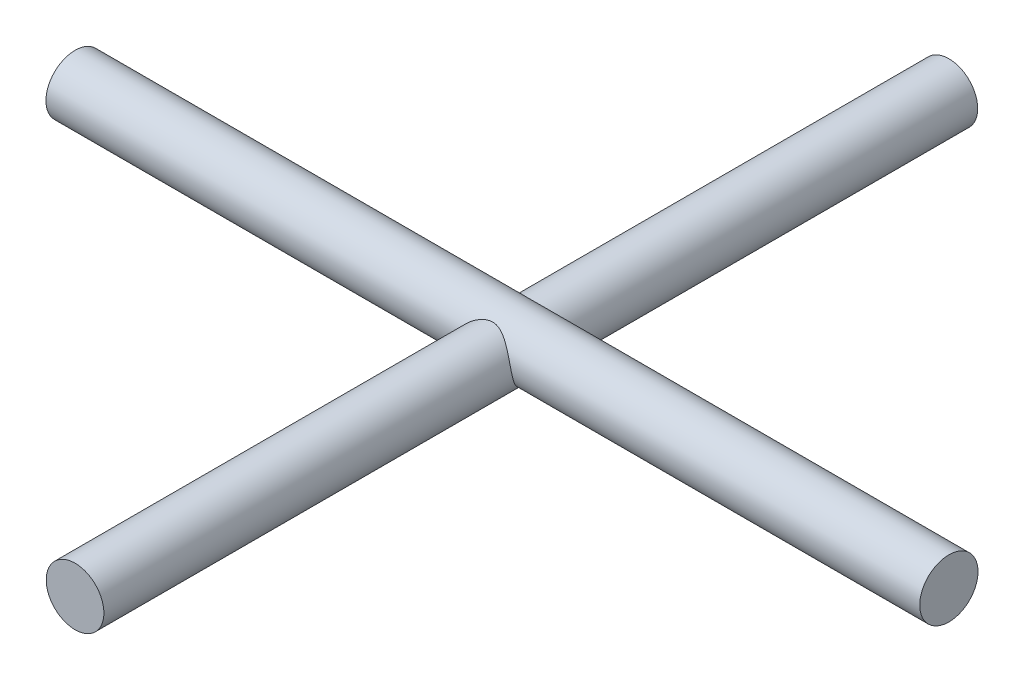
from build123d import *

# Parameters (mm, degrees)
BOSS_EXTRUDE1_DEPTH      = 37.5
BOSS_EXTRUDE1_DEPTH_BACK = 37.5
SKETCH2_R                = 2.475
BOSS_EXTRUDE2_DEPTH      = 37.5
BOSS_EXTRUDE2_DEPTH_BACK = 37.5
SKETCH3_R                = 2.5


with BuildPart() as part:
    # Sketch2 → Boss-Extrude1 (new, two sides: drawn at the far end of the back side and taken through both)
    with BuildSketch(Plane.XY.offset(-BOSS_EXTRUDE1_DEPTH_BACK)):
        Circle(SKETCH2_R)
    extrude(amount=BOSS_EXTRUDE1_DEPTH + BOSS_EXTRUDE1_DEPTH_BACK)

    # Sketch3 → Boss-Extrude2 (add, two sides: drawn at the far end of the back side and taken through both)
    with BuildSketch(Plane(origin=(0, 0, 0), x_dir=(0, 0, -1), z_dir=(1, 0, 0)).offset(-BOSS_EXTRUDE2_DEPTH_BACK)):
        with Locations((0, 0.6)):
            Circle(SKETCH3_R)
    extrude(amount=BOSS_EXTRUDE2_DEPTH + BOSS_EXTRUDE2_DEPTH_BACK)


solid = part.part
